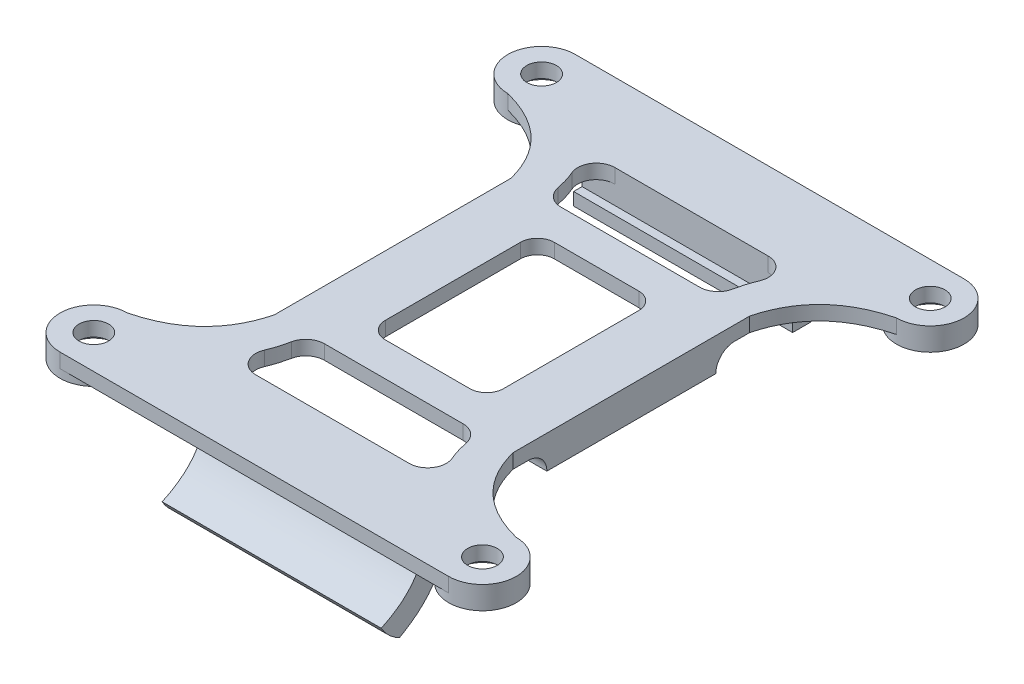
from build123d import *

# Parameters (mm, degrees)
SKETCH1_R           = 4
SKETCH1_R_2         = 1.75
SKETCH1_W           = 28.25
SKETCH1_H           = 28
SKETCH1_W_2         = 20.25
SKETCH1_H_2         = 20
BOSS_EXTRUDE1_DEPTH = 1.7
SKETCH2_W           = 4
SKETCH2_H           = 20
SKETCH2_W_2         = 25.924598982
SKETCH2_H_2         = 2
BOSS_EXTRUDE2_DEPTH = 2.2
SKETCH4_W           = 25.924598982
SKETCH4_H           = 5.2
SKETCH4_H_2         = 2
SKETCH4_H_3         = 0.8
BOSS_EXTRUDE4_DEPTH = 10
CUT_EXTRUDE1_REACH  = 53.731
FILLET2_DEPTH       = 1.7
FILLET2_START       = -14.125
FILLET2_2_DEPTH     = 4
FILLET2_START_2     = 10.125
FILLET2_3_DEPTH     = 4
BOSS_EXTRUDE5_START = 1
SKETCH7_R           = 4
SKETCH7_R_2         = 3
BOSS_EXTRUDE5_DEPTH = 1
SKETCH8_W           = 25.924598982
SKETCH8_H           = 3
BOSS_EXTRUDE6_DEPTH = 1.5
FILLET8_R           = 1
FILLET9_R           = 5
SKETCH9_W           = 3.125
SKETCH9_H           = 20
BOSS_EXTRUDE7_DEPTH = 1.7
FILLET10_R          = 2


with BuildPart() as part:
    # Sketch1 → Boss-Extrude1 (new body)
    # profile 1 of 13: a face of its own
    with BuildSketch(Plane(origin=(0, 0, 0), x_dir=(1, 0, 0), z_dir=(0, 1, 0))):
        with BuildLine():
            Line((23, 30.5), (-23, 30.5))
            ThreePointArc((-23, 30.5), (-20.171572875, 29.328427125), (-19, 26.5))
            ThreePointArc((-19, 26.5), (-20.171572875, 23.671572875), (-23, 22.5))
            Line((-23, 22.5), (-14.125, 22.5))
            Line((-14.125, 22.5), (14.125, 22.5))
            Line((14.125, 22.5), (23, 22.5))
            ThreePointArc((23, 22.5), (19, 26.5), (23, 30.5))
        make_face()
    # profile 2 of 13: a face of its own
    with BuildSketch(Plane(origin=(0, 0, 0), x_dir=(1, 0, 0), z_dir=(0, 1, 0))):
        with Locations((-23, 26.5)):
            Circle(SKETCH1_R)
        with Locations(Location((-23, 26.5, 0), (0, 0, 270))):
            Circle(SKETCH1_R_2, mode=Mode.SUBTRACT)
    # profile 3 of 13: a face of its own
    with BuildSketch(Plane(origin=(0, 0, 0), x_dir=(1, 0, 0), z_dir=(0, 1, 0))):
        with Locations((23, 26.5)):
            Circle(SKETCH1_R)
        with Locations(Location((23, 26.5, 0), (0, 0, 270))):
            Circle(SKETCH1_R_2, mode=Mode.SUBTRACT)
    # profile 4 of 13: a face of its own
    with BuildSketch(Plane(origin=(0, 0, 0), x_dir=(1, 0, 0), z_dir=(0, 1, 0))):
        with BuildLine():
            add(Edge.make_bspline(
                [(23, 22.5), (15.848117011, 20.671722953), (14.125, 14)],
                knots=[0, 0, 0, 1, 1, 1], degree=2))
            Line((23, 22.5), (14.125, 22.5))
            add(Edge.make_bspline(
                [(12.962299491, 21.25), (13.494356114, 21.89718349), (14.125, 22.5)],
                knots=[0.827841915, 0.827841915, 0.827841915, 1, 1, 1], degree=2))
            add(Edge.make_bspline(
                [(10.125, 14), (10.403844137, 18.137943888), (12.962299491, 21.25)],
                knots=[0, 0, 0, 0.827841915, 0.827841915, 0.827841915], degree=2))
            Line((10.125, 14), (14.125, 14))
        make_face()
    # profile 5 of 13: a face of its own
    with BuildSketch(Plane(origin=(0, 0, 0), x_dir=(1, 0, 0), z_dir=(0, 1, 0))):
        with BuildLine():
            Line((-14.125, 22.5), (-23, 22.5))
            add(Edge.make_bspline(
                [(-23, 22.5), (-15.848117011, 20.671722953), (-14.125, 14)],
                knots=[0, 0, 0, 1, 1, 1], degree=2))
            Line((-14.125, 14), (-10.125, 14))
            add(Edge.make_bspline(
                [(-10.125, 14), (-10.403844137, 18.137943888), (-12.962299491, 21.25)],
                knots=[0, 0, 0, 0.827841915, 0.827841915, 0.827841915], degree=2))
            add(Edge.make_bspline(
                [(-12.962299491, 21.25), (-13.494356114, 21.89718349), (-14.125, 22.5)],
                knots=[0.827841915, 0.827841915, 0.827841915, 1, 1, 1], degree=2))
        make_face()
    # profile 6 of 13: a face of its own
    with BuildSketch(Plane(origin=(0, 0, 0), x_dir=(1, 0, 0), z_dir=(0, 1, 0))):
        Rectangle(SKETCH1_W, SKETCH1_H)
        Rectangle(SKETCH1_W_2, SKETCH1_H_2, mode=Mode.SUBTRACT)
    # profile 7 of 13: a face of its own
    with BuildSketch(Plane(origin=(0, 0, 0), x_dir=(1, 0, 0), z_dir=(0, 1, 0))):
        with BuildLine():
            Line((-10.125, -14), (-14.125, -14))
            add(Edge.make_bspline(
                [(-23, -22.5), (-15.848117011, -20.671722953), (-14.125, -14)],
                knots=[0, 0, 0, 1, 1, 1], degree=2))
            Line((-23, -22.5), (-14.125, -22.5))
            add(Edge.make_bspline(
                [(-12.962299491, -21.25), (-13.494356114, -21.89718349), (-14.125, -22.5)],
                knots=[0.827841915, 0.827841915, 0.827841915, 1, 1, 1], degree=2))
            add(Edge.make_bspline(
                [(-10.125, -14), (-10.403844137, -18.137943888), (-12.962299491, -21.25)],
                knots=[0, 0, 0, 0.827841915, 0.827841915, 0.827841915], degree=2))
        make_face()
    # profile 8 of 13: a face of its own
    with BuildSketch(Plane(origin=(0, 0, 0), x_dir=(1, 0, 0), z_dir=(0, 1, 0))):
        with BuildLine():
            add(Edge.make_bspline(
                [(23, -22.5), (15.848117011, -20.671722953), (14.125, -14)],
                knots=[0, 0, 0, 1, 1, 1], degree=2))
            Line((14.125, -14), (10.125, -14))
            add(Edge.make_bspline(
                [(10.125, -14), (10.403844137, -18.137943888), (12.962299491, -21.25)],
                knots=[0, 0, 0, 0.827841915, 0.827841915, 0.827841915], degree=2))
            add(Edge.make_bspline(
                [(12.962299491, -21.25), (13.494356114, -21.89718349), (14.125, -22.5)],
                knots=[0.827841915, 0.827841915, 0.827841915, 1, 1, 1], degree=2))
            Line((14.125, -22.5), (23, -22.5))
        make_face()
    # profile 9 of 13: a face of its own
    with BuildSketch(Plane(origin=(0, 0, 0), x_dir=(1, 0, 0), z_dir=(0, 1, 0))):
        with BuildLine():
            Line((-14.125, -22.5), (-23, -22.5))
            ThreePointArc((-23, -22.5), (-20.171572875, -23.671572875), (-19, -26.5))
            ThreePointArc((-19, -26.5), (-20.171572875, -29.328427125), (-23, -30.5))
            Line((-23, -30.5), (23, -30.5))
            ThreePointArc((23, -30.5), (19, -26.5), (23, -22.5))
            Line((23, -22.5), (14.125, -22.5))
            Line((14.125, -22.5), (-14.125, -22.5))
        make_face()
    # profile 10 of 13: a face of its own
    with BuildSketch(Plane(origin=(0, 0, 0), x_dir=(1, 0, 0), z_dir=(0, 1, 0))):
        with Locations((23, -26.5)):
            Circle(SKETCH1_R)
        with Locations(Location((23, -26.5, 0), (0, 0, 270))):
            Circle(SKETCH1_R_2, mode=Mode.SUBTRACT)
    # profile 11 of 13: a face of its own
    with BuildSketch(Plane(origin=(0, 0, 0), x_dir=(1, 0, 0), z_dir=(0, 1, 0))):
        with Locations((-23, -26.5)):
            Circle(SKETCH1_R)
        with Locations(Location((-23, -26.5, 0), (0, 0, 270))):
            Circle(SKETCH1_R_2, mode=Mode.SUBTRACT)
    # profile 12 of 13: a face of its own
    with BuildSketch(Plane(origin=(0, 0, 0), x_dir=(1, 0, 0), z_dir=(0, 1, 0))):
        with BuildLine():
            Line((14.125, 22.5), (-14.125, 22.5))
            add(Edge.make_bspline(
                [(-12.962299491, 21.25), (-13.494356114, 21.89718349), (-14.125, 22.5)],
                knots=[0.827841915, 0.827841915, 0.827841915, 1, 1, 1], degree=2))
            Line((-12.962299491, 21.25), (12.962299491, 21.25))
            add(Edge.make_bspline(
                [(12.962299491, 21.25), (13.494356114, 21.89718349), (14.125, 22.5)],
                knots=[0.827841915, 0.827841915, 0.827841915, 1, 1, 1], degree=2))
        make_face()
    # profile 13 of 13: a face of its own
    with BuildSketch(Plane(origin=(0, 0, 0), x_dir=(1, 0, 0), z_dir=(0, 1, 0))):
        with BuildLine():
            Line((12.962299491, -21.25), (-12.962299491, -21.25))
            add(Edge.make_bspline(
                [(-12.962299491, -21.25), (-13.494356114, -21.89718349), (-14.125, -22.5)],
                knots=[0.827841915, 0.827841915, 0.827841915, 1, 1, 1], degree=2))
            Line((-14.125, -22.5), (14.125, -22.5))
            add(Edge.make_bspline(
                [(12.962299491, -21.25), (13.494356114, -21.89718349), (14.125, -22.5)],
                knots=[0.827841915, 0.827841915, 0.827841915, 1, 1, 1], degree=2))
        make_face()
    extrude(amount=BOSS_EXTRUDE1_DEPTH)

    # Sketch2 → Boss-Extrude2 (add)
    with BuildSketch(Plane.XZ):
        with Locations((-12.125, 0)):
            Rectangle(SKETCH2_W, SKETCH2_H)
        with Locations((12.125, 0)):
            Rectangle(SKETCH2_W, SKETCH2_H)
        with Locations((0, 22.25)):
            Rectangle(SKETCH2_W_2, SKETCH2_H_2)
        with Locations((0, -22.25)):
            Rectangle(SKETCH2_W_2, SKETCH2_H_2)
    extrude(amount=BOSS_EXTRUDE2_DEPTH)

    # Sketch4 → Boss-Extrude4 (add)
    with BuildSketch(Plane.XZ.offset(2.2)):
        with Locations((0, 25.85)):
            Rectangle(SKETCH4_W, SKETCH4_H)
        with Locations((0, 22.25)):
            Rectangle(SKETCH4_W, SKETCH4_H_2)
        with Locations((0, 20.85)):
            Rectangle(SKETCH4_W, SKETCH4_H_3)
    extrude(amount=BOSS_EXTRUDE4_DEPTH)

    # Sketch5 → Cut-Extrude1 (cut, up to next)
    with BuildSketch(Plane(origin=(12.962299491, 0, 0), x_dir=(0, 0, -1), z_dir=(1, 0, 0)), mode=Mode.PRIVATE) as cut_extrude1_sk1:
        with BuildLine():
            Line((-23.25, -2.2), (-28.45, -2.2))
            Line((-28.45, -2.2), (-28.45, -9.650428017))
            add(Edge.make_bspline(
                [(-23.25, -2.2), (-23.25, -7.289748453), (-28.45, -9.650428017)],
                knots=[0, 0, 0, 1, 1, 1], degree=2))
        make_face()
    cut_extrude1_tool1 = extrude(cut_extrude1_sk1.sketch, amount=-CUT_EXTRUDE1_REACH, mode=Mode.PRIVATE) & part.part
    # Sketch5 → Cut-Extrude1 (cut, up to next)
    with BuildSketch(Plane(origin=(12.962299491, 0, 0), x_dir=(0, 0, -1), z_dir=(1, 0, 0)), mode=Mode.PRIVATE) as cut_extrude1_sk2:
        with BuildLine():
            Line((-20.45, -12.2), (-20.45, -2.2))
            add(Edge.make_bspline(
                [(-20.45, -2.2), (-20.45, -3.265592553), (-20.728768325, -5.427352401), (-22.110619183, -8.304504684), (-23.978754143, -10.229657313), (-25.773852061, -11.446919799), (-26.782566467, -11.968477758), (-27.29255337, -12.2)],
                knots=[0, 0, 0, 0, 0.25, 0.5, 0.75, 0.875, 1, 1, 1, 1], degree=3))
            Line((-27.29255337, -12.2), (-20.45, -12.2))
        make_face()
    cut_extrude1_tool2 = extrude(cut_extrude1_sk2.sketch, amount=-CUT_EXTRUDE1_REACH, mode=Mode.PRIVATE) & part.part
    add(cut_extrude1_tool1.solids().sort_by_distance((12.962299, -5.157437, 26.282752))[0], mode=Mode.SUBTRACT)
    add(cut_extrude1_tool2.solids().sort_by_distance((12.962299, -9.932499, 22.342862))[0], mode=Mode.SUBTRACT)

    # Fillet2: read off the stored shape, not the designer's step
    # Fillet2 outline → Fillet2 (add)
    with BuildSketch(Plane(origin=(0, 0, 0), x_dir=(1, 0, 0), z_dir=(0, 1, 0))):
        with BuildLine():
            add(Edge.make_bspline(
                [(-11.100202276, 18.191883314), (-11.79328482, 19.828032934), (-12.962299491, 21.25)],
                knots=[0.449582688, 0.449582688, 0.449582688, 0.827841915, 0.827841915, 0.827841915], degree=2))
            ThreePointArc((-11.100202276, 18.191883314), (-10.908560529, 20.26493689), (-9.074459017, 21.25))
            Line((-9.074459017, 21.25), (-12.962299491, 21.25))
        make_face()
        with BuildLine():
            ThreePointArc((-8.200248655, 14), (-9.595540354, 14.499070526), (-10.357787541, 15.769853569))
            add(Edge.make_bspline(
                [(-10.125, 14), (-10.186303346, 14.909718991), (-10.357787541, 15.769853569)],
                knots=[0, 0, 0, 0.18199945, 0.18199945, 0.18199945], degree=2))
            Line((-10.125, 14), (-8.200248655, 14))
        make_face()
        with BuildLine():
            Line((12.962299491, 21.25), (9.074459017, 21.25))
            ThreePointArc((9.074459017, 21.25), (10.908560529, 20.26493689), (11.100202276, 18.191883314))
            add(Edge.make_bspline(
                [(11.100202276, 18.191883314), (11.79328482, 19.828032934), (12.962299491, 21.25)],
                knots=[0.449582688, 0.449582688, 0.449582688, 0.827841915, 0.827841915, 0.827841915], degree=2))
        make_face()
        with BuildLine():
            ThreePointArc((10.357787541, 15.769853569), (9.595540354, 14.499070526), (8.200248655, 14))
            Line((8.200248655, 14), (10.125, 14))
            add(Edge.make_bspline(
                [(10.125, 14), (10.186303346, 14.909718991), (10.357787541, 15.769853569)],
                knots=[0, 0, 0, 0.18199945, 0.18199945, 0.18199945], degree=2))
        make_face()
        with BuildLine():
            Line((-12.962299491, -21.25), (-9.074459017, -21.25))
            ThreePointArc((-9.074459017, -21.25), (-10.908560529, -20.26493689), (-11.100202276, -18.191883314))
            add(Edge.make_bspline(
                [(-11.100202276, -18.191883314), (-11.79328482, -19.828032934), (-12.962299491, -21.25)],
                knots=[0.449582688, 0.449582688, 0.449582688, 0.827841915, 0.827841915, 0.827841915], degree=2))
        make_face()
        with BuildLine():
            ThreePointArc((11.100202276, -18.191883314), (10.908560529, -20.26493689), (9.074459017, -21.25))
            Line((9.074459017, -21.25), (12.962299491, -21.25))
            add(Edge.make_bspline(
                [(11.100202276, -18.191883314), (11.79328482, -19.828032934), (12.962299491, -21.25)],
                knots=[0.449582688, 0.449582688, 0.449582688, 0.827841915, 0.827841915, 0.827841915], degree=2))
        make_face()
        with BuildLine():
            add(Edge.make_bspline(
                [(-10.125, -14), (-10.186303346, -14.909718991), (-10.357787541, -15.769853569)],
                knots=[0, 0, 0, 0.18199945, 0.18199945, 0.18199945], degree=2))
            ThreePointArc((-10.357787541, -15.769853569), (-9.595540354, -14.499070526), (-8.200248655, -14))
            Line((-8.200248655, -14), (-10.125, -14))
        make_face()
        with BuildLine():
            ThreePointArc((8.200248655, -14), (9.595540354, -14.499070526), (10.357787541, -15.769853569))
            add(Edge.make_bspline(
                [(10.125, -14), (10.186303346, -14.909718991), (10.357787541, -15.769853569)],
                knots=[0, 0, 0, 0.18199945, 0.18199945, 0.18199945], degree=2))
            Line((10.125, -14), (8.200248655, -14))
        make_face()
    extrude(amount=FILLET2_DEPTH)

    # Fillet2 2 outline → Fillet2 2 (add)
    with BuildSketch(Plane.YZ.offset(FILLET2_START)):
        with BuildLine():
            ThreePointArc((0, 12.2), (-0.644365081, 10.644365081), (-2.2, 10))
            Line((-2.2, 10), (0, 10))
            Line((0, 10), (0, 12.2))
        make_face()
        with BuildLine():
            Line((0, -10), (-2.2, -10))
            ThreePointArc((-2.2, -10), (-0.644365081, -10.644365081), (0, -12.2))
            Line((0, -12.2), (0, -10))
        make_face()
    extrude(amount=FILLET2_2_DEPTH)

    # Fillet2 3 outline → Fillet2 3 (add)
    with BuildSketch(Plane.YZ.offset(FILLET2_START_2)):
        with BuildLine():
            ThreePointArc((0, 12.2), (-0.644365081, 10.644365081), (-2.2, 10))
            Line((-2.2, 10), (0, 10))
            Line((0, 10), (0, 12.2))
        make_face()
        with BuildLine():
            Line((0, -10), (-2.2, -10))
            ThreePointArc((-2.2, -10), (-0.644365081, -10.644365081), (0, -12.2))
            Line((0, -12.2), (0, -10))
        make_face()
    extrude(amount=FILLET2_3_DEPTH)

    # Sketch7 → Boss-Extrude5 (add)
    # profile 1 of 4: a face of its own
    with BuildSketch(Plane.XZ.offset(BOSS_EXTRUDE5_START)):
        with Locations(Location((-23, 26.5, 0), (0, 0, 270))):
            Circle(SKETCH7_R)
        with Locations(Location((-23, 26.5, 0), (0, 0, 270))):
            Circle(SKETCH7_R_2, mode=Mode.SUBTRACT)
    # profile 2 of 4: a face of its own
    with BuildSketch(Plane.XZ.offset(BOSS_EXTRUDE5_START)):
        with Locations(Location((23, 26.5, 0), (0, 0, 90))):
            Circle(SKETCH7_R)
        with Locations(Location((23, 26.5, 0), (0, 0, 90))):
            Circle(SKETCH7_R_2, mode=Mode.SUBTRACT)
    # profile 3 of 4: a face of its own
    with BuildSketch(Plane.XZ.offset(BOSS_EXTRUDE5_START)):
        with Locations(Location((23, -26.5, 0), (0, 0, 270))):
            Circle(SKETCH7_R)
        with Locations(Location((23, -26.5, 0), (0, 0, 270))):
            Circle(SKETCH7_R_2, mode=Mode.SUBTRACT)
    # profile 4 of 4: a face of its own
    with BuildSketch(Plane.XZ.offset(BOSS_EXTRUDE5_START)):
        with Locations(Location((-23, -26.5, 0), (0, 0, 90))):
            Circle(SKETCH7_R)
        with Locations(Location((-23, -26.5, 0), (0, 0, 90))):
            Circle(SKETCH7_R_2, mode=Mode.SUBTRACT)
    extrude(amount=-BOSS_EXTRUDE5_DEPTH)

    # Sketch8 → Boss-Extrude6 (add)
    with BuildSketch(Plane.XZ.offset(2.2)):
        with Locations((0, -21.75)):
            Rectangle(SKETCH8_W, SKETCH8_H)
    extrude(amount=BOSS_EXTRUDE6_DEPTH)

    # Fillet8
    fillet8_edges = [part.edges().sort_by_distance(p)[0] for p in [
        (0, -3.7, -23.25),
    ]]
    fillet(fillet8_edges, radius=FILLET8_R)

    # Fillet9
    # the kernel refuses this fillet: 5 mm, written as the material it takes off along each edge
    with BuildSketch(Plane(origin=(23.858228357, -12.2, 28.45), x_dir=(0, 0, -1), z_dir=(-1, 0, 0))) as fillet9_piece_1:
        with BuildLine():
            CenterArc((4.358371546, -5), FILLET9_R, 90, 60.653791812)
            Line((0, -2.549571983), (0, 0))
            Line((0, 0), (4.358371546, 0))
        make_face()
    extrude(amount=47.716456714, mode=Mode.SUBTRACT)

    # Sketch9 → Boss-Extrude7 (add)
    with BuildSketch(Plane(origin=(0, 1.7, 0), x_dir=(1, 0, 0), z_dir=(0, 1, 0))):
        with Locations((-8.5625, 0)):
            Rectangle(SKETCH9_W, SKETCH9_H)
        with Locations((8.5625, 0)):
            Rectangle(SKETCH9_W, SKETCH9_H)
    extrude(amount=-BOSS_EXTRUDE7_DEPTH)

    # Fillet10
    fillet10_edges = [part.edges().sort_by_distance(p)[0] for p in [
        (-7, 0.85, 10),
        (-7, 0.85, -10),
        (7, 0.85, -10),
        (7, 0.85, 10),
    ]]
    fillet(fillet10_edges, radius=FILLET10_R)


solid = part.part
